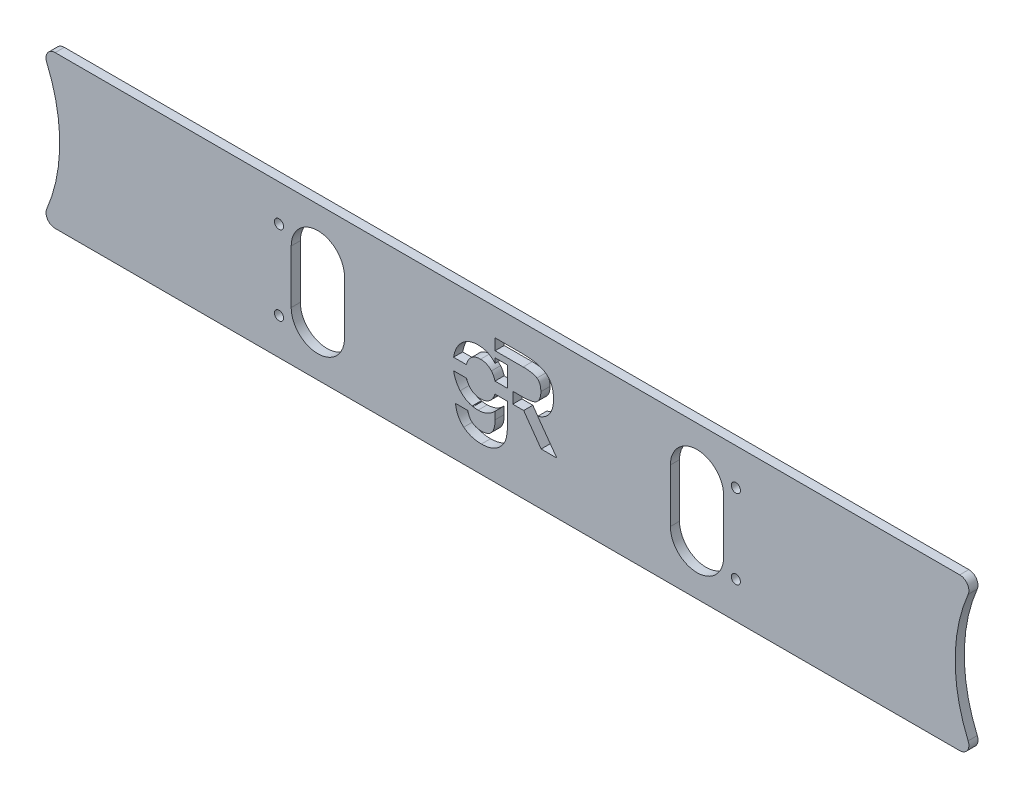
from build123d import *

# Parameters (mm, degrees)
CUT_EXTRUDE1_DEPTH    = 3
SKETCH2_W             = 3
SKETCH2_H             = 5.067353295
CUT_EXTRUDE2_DEPTH    = 4.05735726
SKETCH3_W             = 3
SKETCH3_H             = 3.67986564
CUT_EXTRUDE3_DEPTH    = 8.944532822
SKETCH4_W             = 3
SKETCH4_H             = 3.681676152
CUT_EXTRUDE4_DEPTH    = 3.309012461
SKETCH5_W             = 4.05735726
SKETCH5_H             = 3
CUT_EXTRUDE5_DEPTH    = 1.579382224
CUT_EXTRUDE6_DEPTH    = 154.580550514
CUT_EXTRUDE7_DEPTH    = 154.580550514
DRAFT1_ANGLE          = 35.398648024
DRAFT2_START          = -13
DRAFT2_OUTLINE_W      = 0.065070461
DRAFT2_OUTLINE_H      = 3
DRAFT2_DEPTH          = 0.640220379
F_3_CLEARANCE_HOLE1_D = 3
FILLET1_R             = 7.429700629


with BuildPart() as part:
    # Cut-Extrude1: read off the stored shape, not the designer's step
    # Cut-Extrude1 outline → Cut-Extrude1 (new body)
    with BuildSketch(Plane.XY):
        with BuildLine():
            Line((148.502427242, 25), (-148.502427242, 25))
            ThreePointArc((-148.502427242, 25), (-151.005996124, 23.652919494), (-151.261225782, 20.821428569))
            ThreePointArc((-151.261225782, 20.821428569), (-147, -2e-09), (-151.261225783, -20.821428573))
            ThreePointArc((-151.261225783, -20.821428573), (-151.005996123, -23.652919495), (-148.502427242, -25))
            Line((-148.502427242, -25), (148.502427241, -25))
            ThreePointArc((148.502427241, -25), (151.005996123, -23.652919495), (151.261225783, -20.821428571))
            ThreePointArc((151.261225783, -20.821428571), (147, -6e-09), (151.261225778, 20.82142856))
            ThreePointArc((151.261225778, 20.82142856), (151.00599613, 23.652919485), (148.502427242, 25))
        make_face()
        with BuildLine():
            Line((-11.29447448, -7.017010509), (-11.586068883, -7.017010499))
            add(Edge.make_bspline(
                [(-11.586068883, -7.017010499), (-13.113624484, -6.662460305), (-14.42139015, -5.868418323), (-15.509147544, -4.634666213)],
                knots=[0.287446944, 0.287446944, 0.287446944, 0.287446944, 1, 1, 1, 1], degree=3))
            add(Edge.make_bspline(
                [(-15.509147544, -4.634666213), (-16.640438837, -3.344328673), (-17.355916654, -1.816895921), (-17.655580995, -0.052248085)],
                knots=[0, 0, 0, 0, 0.735113014, 0.735113014, 0.735113014, 0.735113014], degree=3))
            Line((-17.655580995, -0.052248085), (-13.40736732, -0.052248085))
            add(Edge.make_bspline(
                [(-13.40736732, -0.052248085), (-13.206904737, -0.761111927), (-12.891685028, -1.387854916), (-12.461754096, -1.932477053)],
                knots=[0.466173706, 0.466173706, 0.466173706, 0.466173706, 1, 1, 1, 1], degree=3))
            add(Edge.make_bspline(
                [(-12.461754096, -1.932477053), (-11.583957528, -3.048959453), (-10.36970748, -3.606597149), (-7.26769692, -3.606597149), (-6.041376792, -3.042622661), (-5.139741816, -1.914371933)],
                knots=[0, 0, 0, 0, 1, 1, 2, 2, 2, 2], degree=3))
            add(Edge.make_bspline(
                [(-5.139741816, -1.914371933), (-4.66755129, -1.333623963), (-4.329705803, -0.659499347), (-4.126261014, 0.108001915)],
                knots=[0, 0, 0, 0, 0.569236018, 0.569236018, 0.569236018, 0.569236018], degree=3))
            Line((-4.126261014, 0.108001915), (0, 0.108001915))
            Line((0, 0.108001915), (0, -7.554465766))
            add(Edge.make_bspline(
                [(0, -7.554465766), (-0.027057096, -7.870686129), (-0.054114192, -8.186906491), (-0.081171288, -8.503126853), (-0.135184896, -9.134392037), (-0.210622896, -9.690219221), (-0.306881784, -10.171211909), (-0.433240499, -10.802609376), (-0.559599214, -11.434006842), (-0.685957929, -12.065404309)],
                knots=[-0.500931099, -0.500931099, -0.500931099, -0.500931099, 0, 0, 0, 1, 1, 1, 2.312696601, 2.312696601, 2.312696601, 2.312696601], degree=3))
            add(Edge.make_bspline(
                [(-0.685957929, -12.065404309), (-1.124478958, -12.570203706), (-1.562999987, -13.075003104), (-3.588736536, -15.406910861), (-5.770705248, -16.320917669), (-10.892341944, -16.320917669), (-12.822045984, -15.686333213), (-14.336841024, -14.417767805)],
                knots=[-0.276283229, -0.276283229, -0.276283229, -0.276283229, 0, 0, 1, 1, 1.844089526, 1.844089526, 1.844089526, 1.844089526], degree=3))
            add(Edge.make_bspline(
                [(-14.336841024, -14.417767805), (-15.899916384, -13.113595661), (-16.801853112, -11.313343229), (-17.042047704, -9.017010509)],
                knots=[0, 0, 0, 0, 1, 1, 1, 1], degree=3))
            Line((-17.042047704, -9.017010509), (-12.96628344, -9.017010509))
            add(Edge.make_bspline(
                [(-12.96628344, -9.017010509), (-12.810277656, -9.882736997), (-12.551676192, -10.549910669), (-12.1907808, -11.018833277)],
                knots=[0, 0, 0, 0, 1, 1, 1, 1], degree=3))
            add(Edge.make_bspline(
                [(-12.1907808, -11.018833277), (-11.349496224, -12.112684277), (-10.123176096, -12.660062405), (-5.542580736, -12.660062405), (-4.057357392, -10.844420621), (-4.057357392, -7.213438805)],
                knots=[0, 0, 0, 0, 1, 1, 2.842696629, 2.842696629, 2.842696629, 2.842696629], degree=3))
            Line((-4.057357392, -7.213438805), (-4.057357392, -4.761100301))
            add(Edge.make_bspline(
                [(-4.057357392, -4.761100301), (-5.668713072, -6.408364469), (-7.526298384, -7.231543925), (-10.206137881, -7.231543925), (-10.757081475, -7.181382005), (-11.286781914, -7.08031589), (-11.290628142, -7.079582035), (-11.294474369, -7.07884818)],
                knots=[0, 0, 0, 0, 1, 1, 1.27380001, 1.27380001, 1.275802651, 1.275802651, 1.275802651, 1.275802651], degree=3))
            Line((-11.294474369, -7.07884818), (-11.29447448, -7.017010509))
        make_face(mode=Mode.SUBTRACT)
        with BuildLine():
            Line((-6.059771408, 10.434237419), (-5.993425607, 10.434237423))
            add(Edge.make_bspline(
                [(-5.993425607, 10.434237423), (-5.288660214, 10.039109984), (-4.64331055, 9.512636425), (-4.057357392, 8.854855195)],
                knots=[0.600609447, 0.600609447, 0.600609447, 0.600609447, 1, 1, 1, 1], degree=3))
            Line((-4.057357392, 8.854855195), (-4.05735726, 3.787501905))
            Line((-4.05735726, 3.787501905), (-4.08892998, 3.787501916))
            add(Edge.make_bspline(
                [(-4.08892998, 3.787501916), (-4.303318183, 4.691019049), (-4.695706303, 5.461201385), (-5.265874152, 6.098048923)],
                knots=[0.375776454, 0.375776454, 0.375776454, 0.375776454, 1, 1, 1, 1], degree=3))
            add(Edge.make_bspline(
                [(-5.265874152, 6.098048923), (-6.19195104, 7.142412595), (-7.376025888, 7.664443555), (-10.357939152, 7.664443555), (-11.571887448, 7.094132275), (-12.461754096, 5.954113219)],
                knots=[0, 0, 0, 0, 1, 1, 2.066931604, 2.066931604, 2.066931604, 2.066931604], degree=3))
            add(Edge.make_bspline(
                [(-12.461754096, 5.954113219), (-12.946093544, 5.340386726), (-13.284850814, 4.618182958), (-13.477960278, 3.787501916)],
                knots=[0, 0, 0, 0, 0.60138295, 0.60138295, 0.60138295, 0.60138295], degree=3))
            Line((-13.477960278, 3.787501916), (-17.684701686, 3.787501916))
            add(Edge.make_bspline(
                [(-17.684701686, 3.787501916), (-17.41727663, 5.56733029), (-16.746105524, 7.13012985), (-15.671188368, 8.476156435)],
                knots=[0.248786667, 0.248786667, 0.248786667, 0.248786667, 1, 1, 1, 1], degree=3))
            add(Edge.make_bspline(
                [(-15.671188368, 8.476156435), (-14.13255492, 10.375383523), (-12.100858704, 11.325600571), (-8.275116415, 11.325600571), (-7.103027438, 11.040676266), (-6.05977141, 10.470950416)],
                knots=[0, 0, 0, 0, 1, 1, 1.515290098, 1.515290098, 1.515290098, 1.515290098], degree=3))
            Line((-6.05977141, 10.470950416), (-6.059771408, 10.434237419))
        make_face(mode=Mode.SUBTRACT)
        with BuildLine():
            Line((16.236068118, -7.930703309), (5.332259592, -7.930703309))
            Line((5.332259592, -7.930703309), (5.332259592, 0.152931019))
            Line((5.332259592, 0.152931019), (5.056156541, 0.152931019))
            Line((5.056156541, 0.152931019), (5.056156512, 3.834607171))
            add(Edge.make_bspline(
                [(9.73451952, 4.900395235), (8.910133056, 4.188864019), (7.349471712, 3.834607171), (5.056156512, 3.834607171)],
                knots=[0, 0, 0, 0, 1, 1, 1, 1], degree=3))
            add(Edge.make_bspline(
                [(9.73451952, 4.900395235), (10.560414744, 5.610417691), (10.974418488, 6.752549011), (10.974418488, 9.893485579), (10.549551672, 10.971343723), (9.700723296, 11.556139099)],
                knots=[0, 0, 0, 0, 1, 1, 2.000961169, 2.000961169, 2.000961169, 2.000961169], degree=3))
            add(Edge.make_bspline(
                [(5.159657448, 12.434237419), (7.33860864, 12.434237419), (8.851593168, 12.141236227), (9.700723296, 11.556139099)],
                knots=[0, 0, 0, 0, 1, 1, 1, 1], degree=3))
            Line((5.159657448, 12.434237419), (4.88476139, 12.434237419))
            Line((4.88476139, 12.434237419), (4.884761376, 16.114103059))
            add(Edge.make_bspline(
                [(12.761997336, 14.257423003), (11.178704592, 15.495813211), (8.552255184, 16.114103059), (4.884761376, 16.114103059)],
                knots=[0, 0, 0, 0, 1, 1, 1, 1], degree=3))
            add(Edge.make_bspline(
                [(12.761997336, 14.257423003), (14.34378132, 13.019032795), (15.136182072, 11.034108139), (15.136182072, 4.338231259), (13.403220336, 1.838819443), (9.941823144, 0.806525851)],
                knots=[0, 0, 0, 0, 1, 1, 2.453831693, 2.453831693, 2.453831693, 2.453831693], degree=3))
            Line((9.941823144, 0.806525851), (16.236068118, -7.930703309))
        make_face(mode=Mode.SUBTRACT)
    extrude(amount=CUT_EXTRUDE1_DEPTH)

    # Sketch2 → Cut-Extrude2 (cut)
    with BuildSketch(Plane.ZY.offset(4.05735726)):
        with Locations((1.5, 6.321178548)):
            Rectangle(SKETCH2_W, SKETCH2_H)
    extrude(amount=-CUT_EXTRUDE2_DEPTH, mode=Mode.SUBTRACT)

    # Sketch3 → Cut-Extrude3 (cut)
    with BuildSketch(Plane(origin=(4.884761414, 0, 0), x_dir=(0, 0, -1), z_dir=(1, 0, 0))):
        with Locations((-1.5, 14.274170239)):
            Rectangle(SKETCH3_W, SKETCH3_H)
    extrude(amount=-CUT_EXTRUDE3_DEPTH, mode=Mode.SUBTRACT)

    # Sketch4 → Cut-Extrude4 (cut)
    with BuildSketch(Plane(origin=(5.056156541, 0, 0), x_dir=(0, 0, -1), z_dir=(1, 0, 0))):
        with Locations((-1.5, 1.993769095)):
            Rectangle(SKETCH4_W, SKETCH4_H)
    extrude(amount=-CUT_EXTRUDE4_DEPTH, mode=Mode.SUBTRACT)

    # Sketch5 → Cut-Extrude5 (cut)
    with BuildSketch(Plane.XZ.offset(-8.854855195)):
        with Locations((-2.02867863, 1.5)):
            Rectangle(SKETCH5_W, SKETCH5_H)
    extrude(amount=-CUT_EXTRUDE5_DEPTH, mode=Mode.SUBTRACT)

    # Sketch6 → Cut-Extrude6 (cut, through all)
    with BuildSketch(Plane.XY.offset(3)):
        with BuildLine():
            Line((-53.500000021, -8.75), (-53.500000021, 8.75))
            ThreePointArc((-53.500000021, 8.75), (-62.25000001, 17.499999989), (-70.999999999, 8.75))
            Line((-70.999999999, 8.75), (-70.999999999, -8.75))
            ThreePointArc((-70.999999999, -8.75), (-62.25000001, -17.499999989), (-53.500000021, -8.75))
        make_face()
    extrude(amount=-CUT_EXTRUDE6_DEPTH, mode=Mode.SUBTRACT)

    # Sketch7 → Cut-Extrude7 (cut, through all)
    with BuildSketch(Plane(origin=(0, 0, 0), x_dir=(-1, 0, 0), z_dir=(0, 0, -1))):
        with BuildLine():
            Line((-70.999999999, 8.75), (-70.999999999, -8.75))
            ThreePointArc((-70.999999999, -8.75), (-62.25000001, -17.499999989), (-53.500000021, -8.75))
            Line((-53.500000021, -8.75), (-53.500000021, 8.75))
            ThreePointArc((-53.500000021, 8.75), (-62.25000001, 17.499999989), (-70.999999999, 8.75))
        make_face()
    extrude(amount=-CUT_EXTRUDE7_DEPTH, mode=Mode.SUBTRACT)

    # Draft1
    draft1_faces = [part.faces().sort_by_distance(p)[0] for p in [
        (5.332259592, -3.888886145, 1.5),
    ]]
    draft(draft1_faces, Plane.ZX.offset(0.152931019), DRAFT1_ANGLE)

    # Draft2: read off the stored shape, not the designer's step
    # Draft2 outline → Draft2 (add)
    with BuildSketch(Plane(origin=(0, 0, 0), x_dir=(-0.17732595572779303, 0.9841521759490373, 0), z_dir=(0.9841521759490373, 0.17732595572779303, 0)).offset(DRAFT2_START)):
        with Locations((-4.93553793, 1.5)):
            Rectangle(DRAFT2_OUTLINE_W, DRAFT2_OUTLINE_H)
    extrude(amount=DRAFT2_DEPTH)

    # #3 Clearance Hole1 (through all)
    with Locations(Plane.XY.offset(3)):
        with Locations((75, 13), (75, -13), (-75, -13), (-75, 13)):
            Hole(F_3_CLEARANCE_HOLE1_D / 2)

    # Fillet1
    fillet1_edges = [part.edges().sort_by_distance(p)[0] for p in [
        (-0.685957929, -12.065404309, 1.5),
    ]]
    fillet(fillet1_edges, radius=FILLET1_R)


solid = part.part
